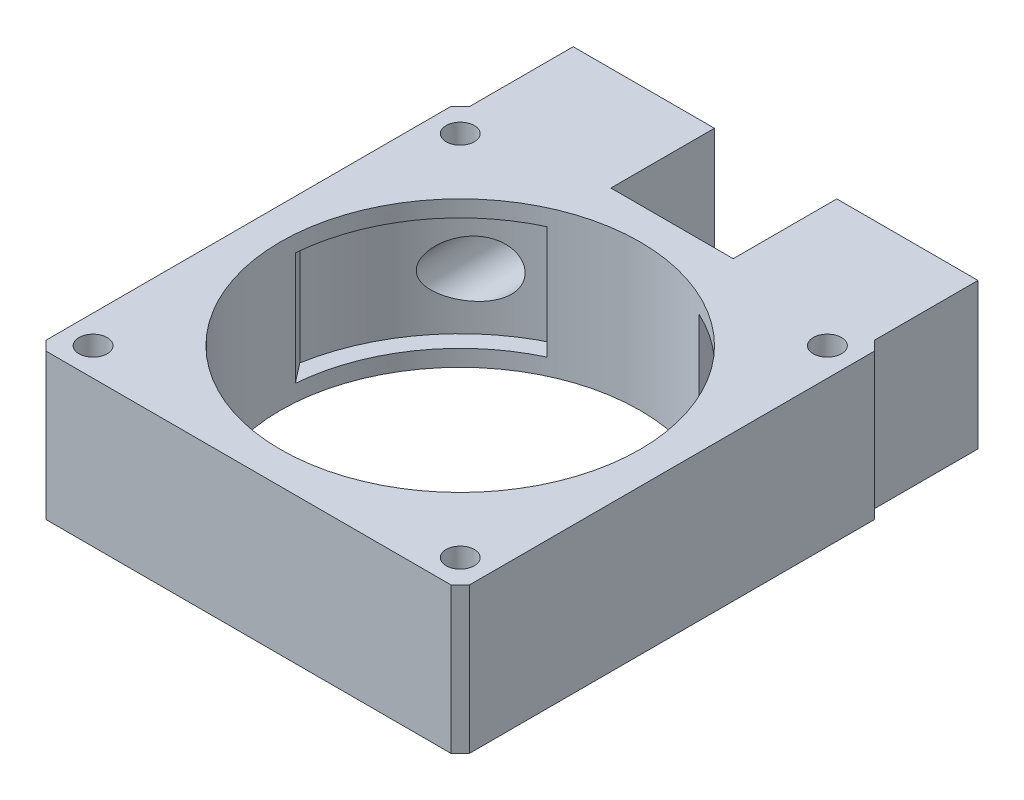
from build123d import *

# Parameters (mm, degrees)
SKETCH_1_W               = 45
SKETCH_1_H               = 45
EXTRUDE_1_DEPTH          = 15.5
SKETCH_2_R               = 19.1
CUT_EXTRUDE_1_DEPTH      = 36.394208566
SKETCH_5_W               = 15
SKETCH_5_H               = 15.5
EXTRUDE_2_DEPTH          = 12
SKETCH_6_R               = 3
CUT_EXTRUDE_4_DEPTH      = 35
SKETCH_7_R               = 1.5
CUT_EXTRUDE_5_DEPTH      = 45.008522016
CUT_EXTRUDE_6_DEPTH      = 6
CUT_EXTRUDE_6_DEPTH_BACK = 6
SKETCH_9_R               = 4.25
CUT_EXTRUDE_7_DEPTH      = 12
CHAMFER_2_SIZE           = 1
CHAMFER_3_SIZE           = 1
CHAMFER_4_SIZE           = 1


# Some blends are built 0.0001 mm under size
with BuildPart() as part:
    # 草图1 → 凸台-拉伸1 (new body)
    with BuildSketch(Plane(origin=(0, 0, 0), x_dir=(1, 0, 0), z_dir=(0, 1, 0))):
        Rectangle(SKETCH_1_W, SKETCH_1_H)
    extrude(amount=EXTRUDE_1_DEPTH)

    # 草图2 → 切除-拉伸1 (cut, through all)
    with BuildSketch(Plane(origin=(0, 15.5, 0), x_dir=(1, 0, 0), z_dir=(0, 1, 0))):
        with Locations(Location((0, 0, 0), (0, 0, 270))):
            Circle(SKETCH_2_R)
    extrude(amount=-CUT_EXTRUDE_1_DEPTH, mode=Mode.SUBTRACT)

    # 草图5 → 凸台-拉伸2 (add)
    with BuildSketch(Plane(origin=(0, 0, -22.5), x_dir=(-1, 0, 0), z_dir=(0, 0, -1))):
        with Locations((14, 7.75)):
            Rectangle(SKETCH_5_W, SKETCH_5_H)
        with Locations((-14, 7.75)):
            Rectangle(SKETCH_5_W, SKETCH_5_H)
    extrude(amount=EXTRUDE_2_DEPTH)

    # 草图6 → 切除-拉伸4 (cut)
    with BuildSketch(Plane(origin=(0, 0, -34.5), x_dir=(-1, 0, 0), z_dir=(0, 0, -1))):
        with Locations((-14, 7.75)):
            Circle(SKETCH_6_R)
        with Locations((14, 7.75)):
            Circle(SKETCH_6_R)
    extrude(amount=-CUT_EXTRUDE_4_DEPTH, mode=Mode.SUBTRACT)

    # 草图7 → 切除-拉伸5 (cut, through all)
    with BuildSketch(Plane(origin=(0, 15.5, 0), x_dir=(1, 0, 0), z_dir=(0, 1, 0))):
        with Locations(Location((-19.5, 19.5, 0), (0, 0, 270))):
            Circle(SKETCH_7_R)
        with Locations(Location((19.5, 19.5, 0), (0, 0, 90))):
            Circle(SKETCH_7_R)
        with Locations(Location((19.5, -19.5, 0), (0, 0, 270))):
            Circle(SKETCH_7_R)
        with Locations(Location((-19.5, -19.5, 0), (0, 0, 90))):
            Circle(SKETCH_7_R)
    extrude(amount=-CUT_EXTRUDE_5_DEPTH, mode=Mode.SUBTRACT)

    # 草图8 → 切除-拉伸6 (cut, two sides: drawn at the far end of the back side and taken through both)
    with BuildSketch(Plane(origin=(0, 7.75, 0), x_dir=(-1, 0, 0), z_dir=(0, -1, 0)).offset(-CUT_EXTRUDE_6_DEPTH_BACK)):
        with BuildLine():
            Line((-8.874983497, 19.032463528), (-8.072008799, 17.310478732))
            ThreePointArc((-8.072008799, 17.310478732), (-15.1530488, 11.627343294), (-18.809828083, 3.316680193))
            Line((-18.809828083, 3.316680193), (-20.680962813, 3.646611731))
            ThreePointArc((-20.680962813, 3.646611731), (-16.660420146, 12.783990009), (-8.874983497, 19.032463528))
        make_face()
        with BuildLine():
            Line((20.680962813, 3.646611731), (18.809828083, 3.316680193))
            ThreePointArc((18.809828083, 3.316680193), (15.1530488, 11.627343294), (8.072008799, 17.310478732))
            Line((8.072008799, 17.310478732), (8.874983497, 19.032463528))
            ThreePointArc((8.874983497, 19.032463528), (16.660420146, 12.783990009), (20.680962813, 3.646611731))
        make_face()
    extrude(amount=CUT_EXTRUDE_6_DEPTH + CUT_EXTRUDE_6_DEPTH_BACK, mode=Mode.SUBTRACT)

    # 草图9 → 切除-拉伸7 (cut)
    with BuildSketch(Plane(origin=(0, 0, -34.5), x_dir=(-1, 0, 0), z_dir=(0, 0, -1))):
        with Locations((-14, 7.75)):
            Circle(SKETCH_9_R)
        with Locations((14, 7.75)):
            Circle(SKETCH_9_R)
    extrude(amount=-CUT_EXTRUDE_7_DEPTH, mode=Mode.SUBTRACT)

    # 倒角1
    # the kernel refuses this chamfer: 2 mm, written as the material it takes off along each edge
    with BuildSketch(Plane(origin=(-18.809828083, 1.75, -3.316680193), x_dir=(-0.09666023054018325, 0, 0.9953174367165073), z_dir=(0, 1, 0))) as chamfer_1_piece_1_section:
        with BuildLine():
            Line((1.811638226, -0.054831322), (-0.147910468, -1.899248595))
            Line((-0.147910468, -1.899248595), (0, 0))
            ThreePointArc((0, 0), (0.933514183, -0.049753736), (1.811638226, -0.054831322))
        make_face()
    chamfer_1_piece_1 = extrude(amount=12, mode=Mode.PRIVATE)
    chamfer_1_piece_1 = chamfer_1_piece_1 & Plane(origin=(0, 7.75, 0), x_dir=(-0.42261826174070266, 0, -0.9063077870366485), z_dir=(0, 1, 0)) * Cylinder(21, 32, mode=Mode.PRIVATE)
    add(chamfer_1_piece_1, mode=Mode.SUBTRACT)
    with BuildSketch(Plane(origin=(18.809828083, 13.75, -3.316680193), x_dir=(0.09666023054018283, 0, 0.9953174367165073), z_dir=(0, -1, 0))) as chamfer_1_piece_2_section:
        with BuildLine():
            Line((1.811638226, -0.054831322), (-0.147910468, -1.899248595))
            Line((-0.147910468, -1.899248595), (0, 0))
            ThreePointArc((0, 0), (0.933514183, -0.049753736), (1.811638226, -0.054831322))
        make_face()
    chamfer_1_piece_2 = extrude(amount=12, mode=Mode.PRIVATE)
    chamfer_1_piece_2 = chamfer_1_piece_2 & Plane(origin=(0, 7.75, 0), x_dir=(0.9848077530122075, 0, -0.17364817766693397), z_dir=(0, 1, 0)) * Cylinder(21, 32, mode=Mode.PRIVATE)
    add(chamfer_1_piece_2, mode=Mode.SUBTRACT)

    # 倒角2
    chamfer_2_edges = [part.edges().sort_by_distance(p)[0] for p in [
        (22.5, 7.75, 22.5),
        (-22.5, 7.75, 22.5),
        (-22.5, 7.75, -22.5),
        (22.5, 7.75, -22.5),
    ]]
    chamfer(chamfer_2_edges, length=CHAMFER_2_SIZE - 0.0001)  # a hair under: the kernel refuses the full size

    # 倒角3
    chamfer_3_edges = [part.edges().sort_by_distance(p)[0] for p in [
        (18.25, 7.75, -22.5),
        (-9.75, 7.75, -22.5),
    ]]
    chamfer(chamfer_3_edges, length=CHAMFER_3_SIZE)

    # 倒角4
    chamfer_4_edges = [part.edges().sort_by_distance(p)[0] for p in [
        (6.5, 7.75, -34.5),
        (14, 15.5, -34.5),
        (21.5, 7.75, -34.5),
        (14, 0, -34.5),
        (-21.5, 7.75, -34.5),
        (-14, 15.5, -34.5),
        (-6.5, 7.75, -34.5),
        (-14, 0, -34.5),
    ]]
    chamfer(chamfer_4_edges, length=CHAMFER_4_SIZE)


solid = part.part
